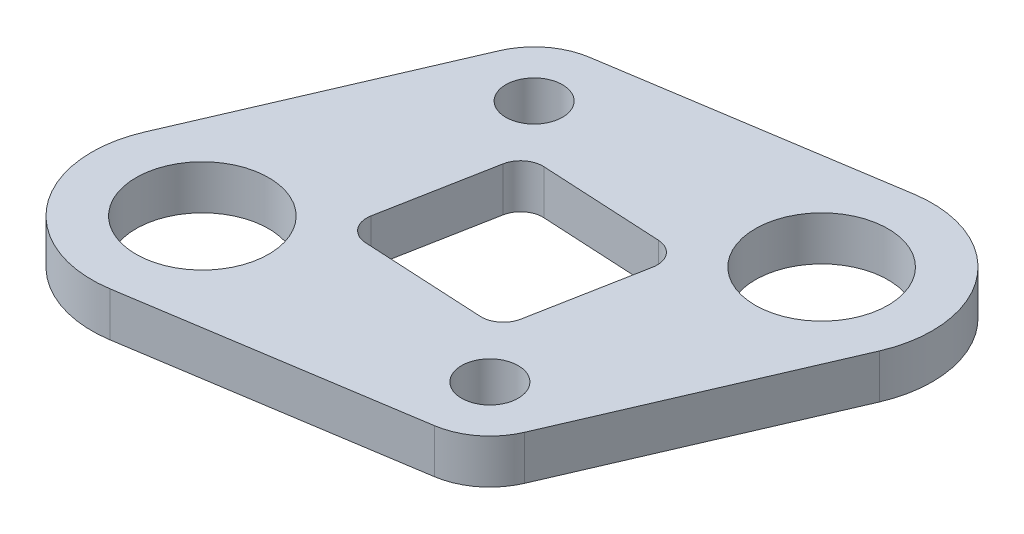
from build123d import *

# Parameters (mm, degrees)
SKETCH1_R           = 4.7625
SKETCH1_R_2         = 2.032
BOSS_EXTRUDE1_DEPTH = 3.175


with BuildPart() as part:
    # Sketch1 → Boss-Extrude1 (new body)
    with BuildSketch(Plane(origin=(0, 0, 0), x_dir=(1, 0, 0), z_dir=(0, 1, 0))):
        with BuildLine():
            Line((0.389757167, 20.936935708), (-7.287904722, 3.144892847))
            ThreePointArc((-7.287904722, 3.144892847), (-6.275733268, -4.859946317), (1.221153846, -7.843002584))
            Line((1.221153846, -7.843002584), (21.370192308, -4.70580155))
            ThreePointArc((21.370192308, -4.70580155), (23.55346779, -3.765439961), (25.010242833, -1.886935708))
            Line((25.010242833, -1.886935708), (32.687904722, 15.905107153))
            ThreePointArc((32.687904722, 15.905107153), (31.675733268, 23.909946317), (24.178846154, 26.893002584))
            Line((24.178846154, 26.893002584), (4.029807692, 23.75580155))
            ThreePointArc((4.029807692, 23.75580155), (1.84653221, 22.815439961), (0.389757167, 20.936935708))
        make_face()
        Circle(SKETCH1_R, mode=Mode.SUBTRACT)
        with Locations((25.4, 19.05)):
            Circle(SKETCH1_R, mode=Mode.SUBTRACT)
        with Locations((20.6375, 0)):
            Circle(SKETCH1_R_2, mode=Mode.SUBTRACT)
        with Locations((4.7625, 19.05)):
            Circle(SKETCH1_R_2, mode=Mode.SUBTRACT)
        with BuildLine():
            Line((7.527921513, 4.190425609), (16.202386897, 3.731925143))
            ThreePointArc((16.202386897, 3.731925143), (17.266640314, 4.068672028), (17.846127168, 5.022731138))
            Line((17.846127168, 5.022731138), (19.348233823, 12.97980626))
            ThreePointArc((19.348233823, 12.97980626), (19.036826198, 14.254748277), (17.872078487, 14.859574391))
            Line((17.872078487, 14.859574391), (9.197613103, 15.318074857))
            ThreePointArc((9.197613103, 15.318074857), (8.133359686, 14.981327972), (7.553872832, 14.027268862))
            Line((7.553872832, 14.027268862), (6.051766177, 6.07019374))
            ThreePointArc((6.051766177, 6.07019374), (6.363173802, 4.795251723), (7.527921513, 4.190425609))
        make_face(mode=Mode.SUBTRACT)
    extrude(amount=BOSS_EXTRUDE1_DEPTH)


solid = part.part
